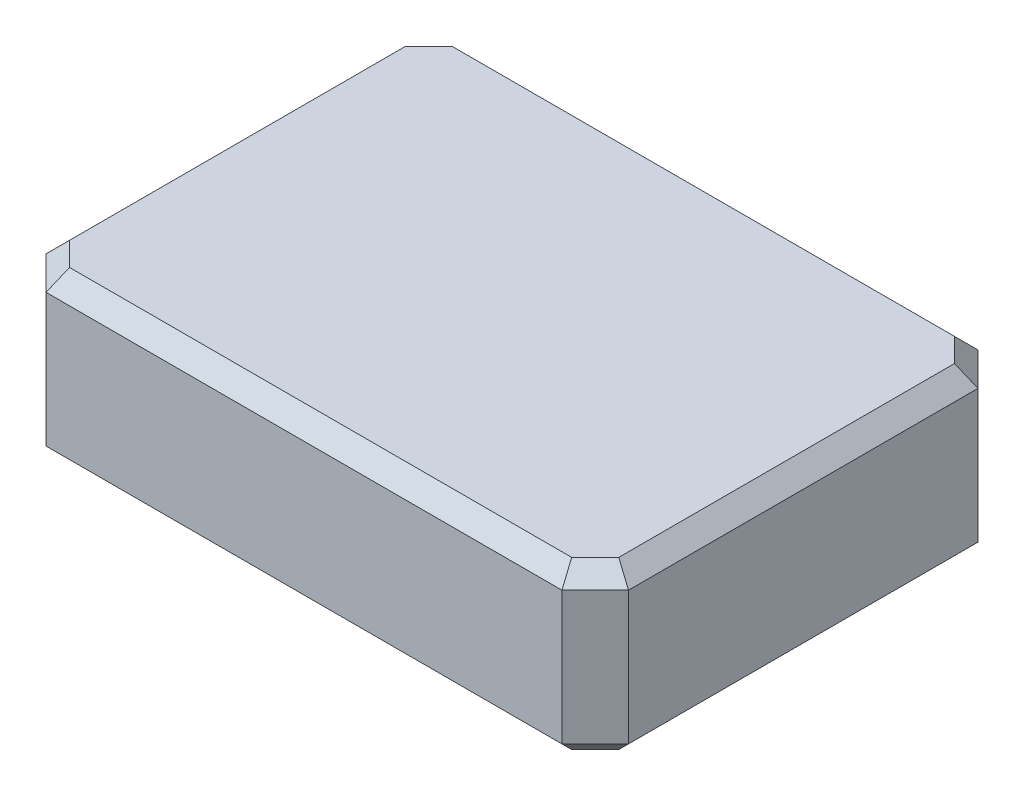
from build123d import *

# Parameters (mm, degrees)
SKETCH1_W           = 350
SKETCH1_H           = 250
BOSS_EXTRUDE1_DEPTH = 50
CHAMFER1_SIZE       = 20
CHAMFER2_SIZE       = 10


with BuildPart() as part:
    # Sketch1 → Boss-Extrude1 (new, symmetric)
    with BuildSketch(Plane(origin=(0, 0, 0), x_dir=(1, 0, 0), z_dir=(0, 1, 0))):
        Rectangle(SKETCH1_W, SKETCH1_H)
    extrude(amount=BOSS_EXTRUDE1_DEPTH, both=True)

    # Chamfer1
    chamfer1_edges = [part.edges().sort_by_distance(p)[0] for p in [
        (-175, 0, -125),
        (-175, 0, 125),
        (175, 0, -125),
        (175, 0, 125),
    ]]
    chamfer(chamfer1_edges, length=CHAMFER1_SIZE)

    # Chamfer2
    chamfer2_edges = [part.edges().sort_by_distance(p)[0] for p in [
        (165, 50, -115),
        (175, 50, 0),
        (165, 50, 115),
        (0, 50, 125),
        (-165, 50, 115),
        (-175, 50, 0),
        (-165, 50, -115),
        (0, 50, -125),
        (-165, -50, 115),
        (0, -50, 125),
        (165, -50, 115),
        (175, -50, 0),
        (165, -50, -115),
        (0, -50, -125),
        (-165, -50, -115),
        (-175, -50, 0),
    ]]
    chamfer(chamfer2_edges, length=CHAMFER2_SIZE)


solid = part.part
